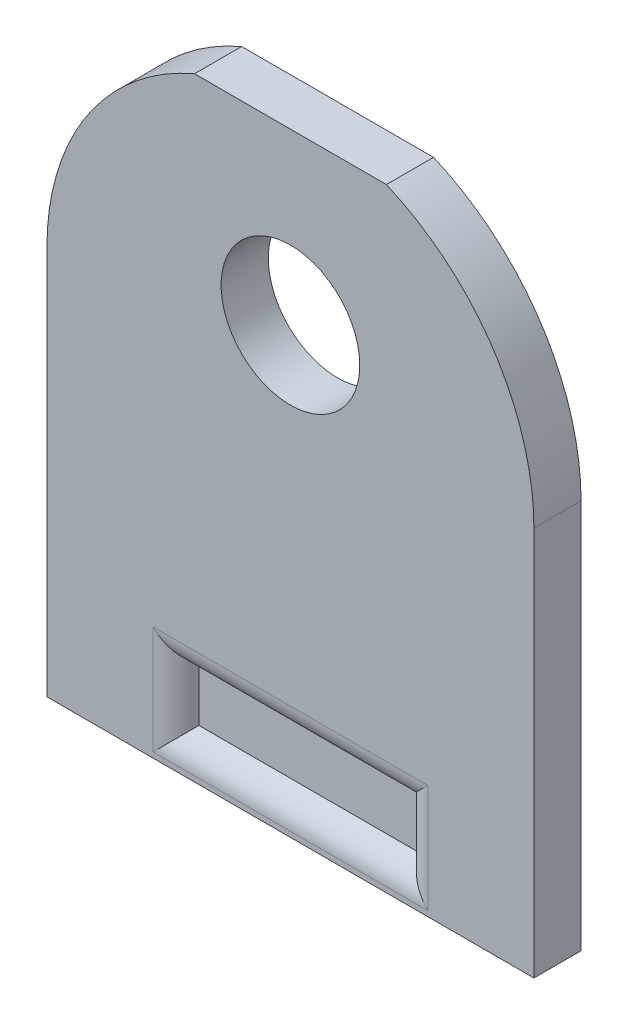
from build123d import *

# Parameters (mm, degrees)
SKETCH1_R           = 2.5
BOSS_EXTRUDE1_DEPTH = 1.7
CUT_EXTRUDE4_DEPTH  = 24.372045268
SKETCH6_W           = 17.56
SKETCH6_H           = 1.7
BOSS_EXTRUDE4_DEPTH = 7.5
SKETCH9_W           = 8
SKETCH9_H           = 2
CUT_EXTRUDE2_DEPTH  = 0.7
FILLET1_R           = 1


with BuildPart() as part:
    # Sketch1 → Boss-Extrude1 (new body)
    with BuildSketch(Plane.XY):
        with BuildLine():
            Line((0, 0), (17.56, 0))
            Line((17.56, 0), (17.56, 6.55))
            ThreePointArc((17.56, 6.55), (8.78, 15.33), (0, 6.55))
            Line((0, 6.55), (0, 0))
        make_face()
        with Locations((8.78, 8.5)):
            Circle(SKETCH1_R, mode=Mode.SUBTRACT)
    extrude(amount=BOSS_EXTRUDE1_DEPTH)

    # Sketch3 → Cut-Extrude4 (cut, through all)
    with BuildSketch(Plane.XY.offset(1.7)):
        with BuildLine():
            ThreePointArc((12.24, 14.619498126), (8.78, 15.33), (5.32, 14.619498126))
            Line((5.32, 14.619498126), (12.24, 14.619498126))
        make_face()
    extrude(amount=-CUT_EXTRUDE4_DEPTH, mode=Mode.SUBTRACT)

    # Sketch6 → Boss-Extrude4 (add)
    with BuildSketch(Plane.XZ):
        with Locations((8.78, 0.85)):
            Rectangle(SKETCH6_W, SKETCH6_H)
    extrude(amount=BOSS_EXTRUDE4_DEPTH)

    # Sketch9 → Cut-Extrude2 (cut)
    with BuildSketch(Plane.XY.offset(1.7)):
        with Locations((8.78, -5.353166831)):
            Rectangle(SKETCH9_W, SKETCH9_H)
    extrude(amount=-CUT_EXTRUDE2_DEPTH, mode=Mode.SUBTRACT)

    # Fillet1
    # the kernel refuses this fillet: 1 mm, written as the material it takes off along each edge
    with BuildSketch(Plane(origin=(12.78, -4.353166831, 1.7), x_dir=(1, 0, 0), z_dir=(0, -1, 0)), Plane(origin=(4.78, -6.353166831, 1.7), x_dir=(-1, 0, 0), z_dir=(0, 1, 0))) as fillet1_piece_1:
        with BuildLine():
            CenterArc((0.953939201, -1), FILLET1_R, 90, 72.542396876)
            Line((0, -0.7), (-0.019078784, -0.694))
            ThreePointArc((-0.019078784, -0.694), (-0.02, -0.35), (-0.02, 0))
            Line((-0.02, 0), (0, 0.02))
            Line((0, 0.02), (0.953939201, 0.02))
            Line((0.953939201, 0.02), (0.953939201, 0))
        make_face()
    extrude(amount=2, mode=Mode.SUBTRACT)
    with BuildSketch(Plane(origin=(12.78, -6.353166831, 1.7), x_dir=(0, -1, 0), z_dir=(-1, 0, 0)), Plane(origin=(4.78, -4.353166831, 1.7), x_dir=(0, 1, 0), z_dir=(1, 0, 0))) as fillet1_piece_2:
        with BuildLine():
            CenterArc((0.953939201, -1), FILLET1_R, 90, 72.542396876)
            Line((0, -0.7), (-0.019078784, -0.694))
            ThreePointArc((-0.019078784, -0.694), (-0.02, -0.35), (-0.02, 0))
            Line((-0.02, 0), (0, 0.02))
            Line((0, 0.02), (0.953939201, 0.02))
            Line((0.953939201, 0.02), (0.953939201, 0))
        make_face()
    extrude(amount=8, mode=Mode.SUBTRACT)
    with BuildSketch(Plane(origin=(12.78, -1.968318828, 1.7), x_dir=(1, 0, 0), z_dir=(0, -1, 0))) as fillet1_piece_3a_section:
        with BuildLine():
            CenterArc((0.953939201, -1), FILLET1_R, 90, 72.542396876)
            Line((0, -0.7), (-0.019078784, -0.694))
            ThreePointArc((-0.019078784, -0.694), (-0.02, -0.35), (-0.02, 0))
            Line((-0.02, 0), (0, 0.02))
            Line((0, 0.02), (0.953939201, 0.02))
            Line((0.953939201, 0.02), (0.953939201, 0))
        make_face()
    fillet1_piece_3a = extrude(amount=4.384848004, mode=Mode.PRIVATE)
    fillet1_piece_3a = split(fillet1_piece_3a, bisect_by=Plane(origin=(13.007122588, -4.353166831, 1.5212182), z_dir=(0, 1, 0)), keep=Keep.TOP, mode=Mode.PRIVATE)
    with BuildSketch(Plane(origin=(4.78, -4.353166831, 1.7), x_dir=(0, 1, 0), z_dir=(1, 0, 0))) as fillet1_piece_3b_section:
        with BuildLine():
            CenterArc((0.953939201, -1), FILLET1_R, 90, 72.542396876)
            Line((0, -0.7), (-0.019078784, -0.694))
            ThreePointArc((-0.019078784, -0.694), (-0.02, -0.35), (-0.02, 0))
            Line((-0.02, 0), (0, 0.02))
            Line((0, 0.02), (0.953939201, 0.02))
            Line((0.953939201, 0.02), (0.953939201, 0))
        make_face()
    fillet1_piece_3b = extrude(amount=10.384848004, mode=Mode.PRIVATE)
    fillet1_piece_3b = split(fillet1_piece_3b, bisect_by=Plane(origin=(12.78, -4.126044244, 1.5212182), z_dir=(1, 0, 0)), keep=Keep.TOP, mode=Mode.PRIVATE)
    fillet1_piece_3 = fillet1_piece_3a & fillet1_piece_3b
    add(fillet1_piece_3, mode=Mode.SUBTRACT)
    with BuildSketch(Plane(origin=(12.78, -4.353166831, 1.7), x_dir=(1, 0, 0), z_dir=(0, -1, 0))) as fillet1_piece_4a_section:
        with BuildLine():
            CenterArc((0.953939201, -1), FILLET1_R, 90, 72.542396876)
            Line((0, -0.7), (-0.019078784, -0.694))
            ThreePointArc((-0.019078784, -0.694), (-0.02, -0.35), (-0.02, 0))
            Line((-0.02, 0), (0, 0.02))
            Line((0, 0.02), (0.953939201, 0.02))
            Line((0.953939201, 0.02), (0.953939201, 0))
        make_face()
    fillet1_piece_4a = extrude(amount=4.384848004, mode=Mode.PRIVATE)
    fillet1_piece_4a = split(fillet1_piece_4a, bisect_by=Plane(origin=(13.007122588, -6.353166831, 1.5212182), z_dir=(0, -1, 0)), keep=Keep.TOP, mode=Mode.PRIVATE)
    with BuildSketch(Plane(origin=(15.164848004, -6.353166831, 1.7), x_dir=(0, -1, 0), z_dir=(-1, 0, 0))) as fillet1_piece_4b_section:
        with BuildLine():
            CenterArc((0.953939201, -1), FILLET1_R, 90, 72.542396876)
            Line((0, -0.7), (-0.019078784, -0.694))
            ThreePointArc((-0.019078784, -0.694), (-0.02, -0.35), (-0.02, 0))
            Line((-0.02, 0), (0, 0.02))
            Line((0, 0.02), (0.953939201, 0.02))
            Line((0.953939201, 0.02), (0.953939201, 0))
        make_face()
    fillet1_piece_4b = extrude(amount=10.384848004, mode=Mode.PRIVATE)
    fillet1_piece_4b = split(fillet1_piece_4b, bisect_by=Plane(origin=(12.78, -6.580289419, 1.5212182), z_dir=(1, 0, 0)), keep=Keep.TOP, mode=Mode.PRIVATE)
    fillet1_piece_4 = fillet1_piece_4a & fillet1_piece_4b
    add(fillet1_piece_4, mode=Mode.SUBTRACT)
    with BuildSketch(Plane(origin=(4.78, -8.738014835, 1.7), x_dir=(-1, 0, 0), z_dir=(0, 1, 0))) as fillet1_piece_5a_section:
        with BuildLine():
            CenterArc((0.953939201, -1), FILLET1_R, 90, 72.542396876)
            Line((0, -0.7), (-0.019078784, -0.694))
            ThreePointArc((-0.019078784, -0.694), (-0.02, -0.35), (-0.02, 0))
            Line((-0.02, 0), (0, 0.02))
            Line((0, 0.02), (0.953939201, 0.02))
            Line((0.953939201, 0.02), (0.953939201, 0))
        make_face()
    fillet1_piece_5a = extrude(amount=4.384848004, mode=Mode.PRIVATE)
    fillet1_piece_5a = split(fillet1_piece_5a, bisect_by=Plane(origin=(4.552877412, -6.353166831, 1.5212182), z_dir=(0, -1, 0)), keep=Keep.TOP, mode=Mode.PRIVATE)
    with BuildSketch(Plane(origin=(12.78, -6.353166831, 1.7), x_dir=(0, -1, 0), z_dir=(-1, 0, 0))) as fillet1_piece_5b_section:
        with BuildLine():
            CenterArc((0.953939201, -1), FILLET1_R, 90, 72.542396876)
            Line((0, -0.7), (-0.019078784, -0.694))
            ThreePointArc((-0.019078784, -0.694), (-0.02, -0.35), (-0.02, 0))
            Line((-0.02, 0), (0, 0.02))
            Line((0, 0.02), (0.953939201, 0.02))
            Line((0.953939201, 0.02), (0.953939201, 0))
        make_face()
    fillet1_piece_5b = extrude(amount=10.384848004, mode=Mode.PRIVATE)
    fillet1_piece_5b = split(fillet1_piece_5b, bisect_by=Plane(origin=(4.78, -6.580289419, 1.5212182), z_dir=(-1, 0, 0)), keep=Keep.TOP, mode=Mode.PRIVATE)
    fillet1_piece_5 = fillet1_piece_5a & fillet1_piece_5b
    add(fillet1_piece_5, mode=Mode.SUBTRACT)
    with BuildSketch(Plane(origin=(2.395151996, -4.353166831, 1.7), x_dir=(0, 1, 0), z_dir=(1, 0, 0))) as fillet1_piece_6a_section:
        with BuildLine():
            CenterArc((0.953939201, -1), FILLET1_R, 90, 72.542396876)
            Line((0, -0.7), (-0.019078784, -0.694))
            ThreePointArc((-0.019078784, -0.694), (-0.02, -0.35), (-0.02, 0))
            Line((-0.02, 0), (0, 0.02))
            Line((0, 0.02), (0.953939201, 0.02))
            Line((0.953939201, 0.02), (0.953939201, 0))
        make_face()
    fillet1_piece_6a = extrude(amount=10.384848004, mode=Mode.PRIVATE)
    fillet1_piece_6a = split(fillet1_piece_6a, bisect_by=Plane(origin=(4.78, -4.126044244, 1.5212182), z_dir=(-1, 0, 0)), keep=Keep.TOP, mode=Mode.PRIVATE)
    with BuildSketch(Plane(origin=(4.78, -6.353166831, 1.7), x_dir=(-1, 0, 0), z_dir=(0, 1, 0))) as fillet1_piece_6b_section:
        with BuildLine():
            CenterArc((0.953939201, -1), FILLET1_R, 90, 72.542396876)
            Line((0, -0.7), (-0.019078784, -0.694))
            ThreePointArc((-0.019078784, -0.694), (-0.02, -0.35), (-0.02, 0))
            Line((-0.02, 0), (0, 0.02))
            Line((0, 0.02), (0.953939201, 0.02))
            Line((0.953939201, 0.02), (0.953939201, 0))
        make_face()
    fillet1_piece_6b = extrude(amount=4.384848004, mode=Mode.PRIVATE)
    fillet1_piece_6b = split(fillet1_piece_6b, bisect_by=Plane(origin=(4.552877412, -4.353166831, 1.5212182), z_dir=(0, 1, 0)), keep=Keep.TOP, mode=Mode.PRIVATE)
    fillet1_piece_6 = fillet1_piece_6a & fillet1_piece_6b
    add(fillet1_piece_6, mode=Mode.SUBTRACT)


solid = part.part
